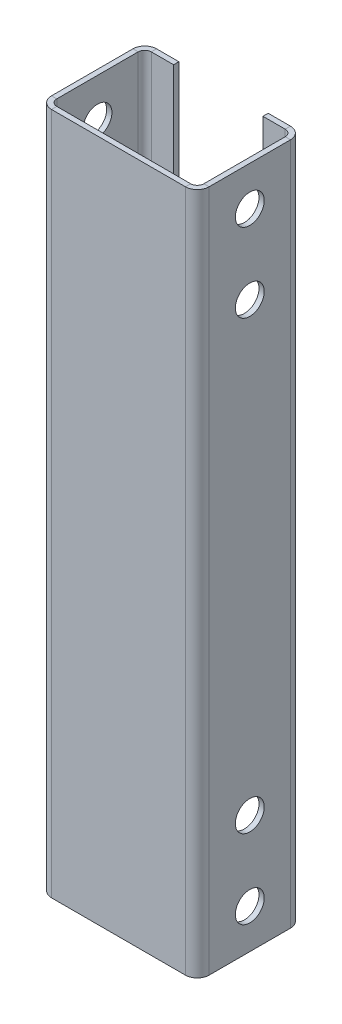
from build123d import *

# Parameters (mm, degrees)
SKETCH1_W                      = 60
SKETCH1_H                      = 260
BASE_FLANGE1_DEPTH             = 2
EDGE_FLANGE1_STRIP_W           = 13
EDGE_FLANGE1_STRIP_H           = 2
EDGE_FLANGE1_STRIP_CUT_DEPTH   = 260
EDGE_FLANGE1_STRIP_2_W         = 13
EDGE_FLANGE1_STRIP_2_H         = 2
EDGE_FLANGE1_STRIP_CUT_2_DEPTH = 260
EDGE_FLANGE1_DEPTH             = 260
EDGE_FLANGE1_BEND_DEPTH        = 260
EDGE_FLANGE2_STRIP_W           = 13
EDGE_FLANGE2_STRIP_H           = 2
EDGE_FLANGE2_STRIP_CUT_DEPTH   = 260
EDGE_FLANGE2_STRIP_2_W         = 13
EDGE_FLANGE2_STRIP_2_H         = 2
EDGE_FLANGE2_STRIP_CUT_2_DEPTH = 260
EDGE_FLANGE2_DEPTH             = 260
EDGE_FLANGE2_BEND_DEPTH        = 260
SKETCH18_R                     = 5.5
CUT_EXTRUDE1_DEPTH             = 149.660687473


# Sheet-metal steps are written as plain solids
with BuildPart() as part:
    # Sketch1 → Base-Flange1 (new body)
    with BuildSketch(Plane.XY):
        Rectangle(SKETCH1_W, SKETCH1_H)
    extrude(amount=-BASE_FLANGE1_DEPTH)

    # Edge-Flange1 strip (across the edge) → Edge-Flange1 strip cut (cut)
    with BuildSketch(Plane(origin=(30, 130, -2), x_dir=(-1, 0, 0), z_dir=(0, -1, 0))):
        with Locations((-2, -1)):
            Rectangle(EDGE_FLANGE1_STRIP_W, EDGE_FLANGE1_STRIP_H)
    extrude(amount=EDGE_FLANGE1_STRIP_CUT_DEPTH, mode=Mode.SUBTRACT)

    # Edge-Flange1 strip 2 (across the edge) → Edge-Flange1 strip cut 2 (cut)
    with BuildSketch(Plane(origin=(-30, -130, -2), x_dir=(1, 0, 0), z_dir=(0, 1, 0))):
        with Locations((-2, -1)):
            Rectangle(EDGE_FLANGE1_STRIP_2_W, EDGE_FLANGE1_STRIP_2_H)
    extrude(amount=EDGE_FLANGE1_STRIP_CUT_2_DEPTH, mode=Mode.SUBTRACT)

    # Edge-Flange1 section (across the edge) → Edge-Flange1 (add)
    with BuildSketch(Plane(origin=(30, 130, -2), x_dir=(-1, 0, 0), z_dir=(0, -1, 0))):
        with BuildLine():
            Line((0, 2.5), (0, 38))
            Line((0, 38), (2, 38))
            Line((2, 38), (2, 2.5))
            ThreePointArc((2, 2.5), (2.732233047, 0.732233047), (4.5, 0))
            Line((4.5, 0), (4.5, -2))
            ThreePointArc((4.5, -2), (1.318019485, -0.681980515), (0, 2.5))
        make_face()
    extrude(amount=EDGE_FLANGE1_DEPTH)

    # Edge-Flange1 section 2 (across the edge) → Edge-Flange1 bend (add)
    with BuildSketch(Plane(origin=(-30, -130, -2), x_dir=(1, 0, 0), z_dir=(0, 1, 0))):
        with BuildLine():
            Line((0, 2.5), (0, 38))
            Line((0, 38), (2, 38))
            Line((2, 38), (2, 2.5))
            ThreePointArc((2, 2.5), (2.732233047, 0.732233047), (4.5, 0))
            Line((4.5, 0), (4.5, -2))
            ThreePointArc((4.5, -2), (1.318019485, -0.681980515), (0, 2.5))
        make_face()
    extrude(amount=EDGE_FLANGE1_BEND_DEPTH)

    # Edge-Flange2 strip (across the edge) → Edge-Flange2 strip cut (cut)
    with BuildSketch(Plane(origin=(28, 130, -40), x_dir=(0, 0, 1), z_dir=(0, -1, 0))):
        with Locations((-2, -1)):
            Rectangle(EDGE_FLANGE2_STRIP_W, EDGE_FLANGE2_STRIP_H)
    extrude(amount=EDGE_FLANGE2_STRIP_CUT_DEPTH, mode=Mode.SUBTRACT)

    # Edge-Flange2 strip 2 (across the edge) → Edge-Flange2 strip cut 2 (cut)
    with BuildSketch(Plane(origin=(-28, -130, -40), x_dir=(0, 0, 1), z_dir=(0, 1, 0))):
        with Locations((-2, -1)):
            Rectangle(EDGE_FLANGE2_STRIP_2_W, EDGE_FLANGE2_STRIP_2_H)
    extrude(amount=EDGE_FLANGE2_STRIP_CUT_2_DEPTH, mode=Mode.SUBTRACT)

    # Edge-Flange2 section (across the edge) → Edge-Flange2 (add)
    with BuildSketch(Plane(origin=(28, 130, -40), x_dir=(0, 0, 1), z_dir=(0, -1, 0))):
        with BuildLine():
            Line((0, 2.5), (0, 11))
            Line((0, 11), (2, 11))
            Line((2, 11), (2, 2.5))
            ThreePointArc((2, 2.5), (2.732233047, 0.732233047), (4.5, 0))
            Line((4.5, 0), (4.5, -2))
            ThreePointArc((4.5, -2), (1.318019485, -0.681980515), (0, 2.5))
        make_face()
    extrude(amount=EDGE_FLANGE2_DEPTH)

    # Edge-Flange2 section 2 (across the edge) → Edge-Flange2 bend (add)
    with BuildSketch(Plane(origin=(-28, -130, -40), x_dir=(0, 0, 1), z_dir=(0, 1, 0))):
        with BuildLine():
            Line((0, 2.5), (0, 11))
            Line((0, 11), (2, 11))
            Line((2, 11), (2, 2.5))
            ThreePointArc((2, 2.5), (2.732233047, 0.732233047), (4.5, 0))
            Line((4.5, 0), (4.5, -2))
            ThreePointArc((4.5, -2), (1.318019485, -0.681980515), (0, 2.5))
        make_face()
    extrude(amount=EDGE_FLANGE2_BEND_DEPTH)

    # Sketch18 → Cut-Extrude1 (cut, symmetric)
    with BuildSketch(Plane(origin=(30, 0, 0), x_dir=(0, 0, -1), z_dir=(1, 0, 0))):
        with Locations((20, -115)):
            Circle(SKETCH18_R)
        with Locations((20, -85)):
            Circle(SKETCH18_R)
    cut_extrude1 = extrude(amount=CUT_EXTRUDE1_DEPTH, both=True, mode=Mode.SUBTRACT)

    # Mirror1: Cut-Extrude1 across plane
    add(cut_extrude1.mirror(Plane.ZX), mode=Mode.SUBTRACT)


solid = part.part
